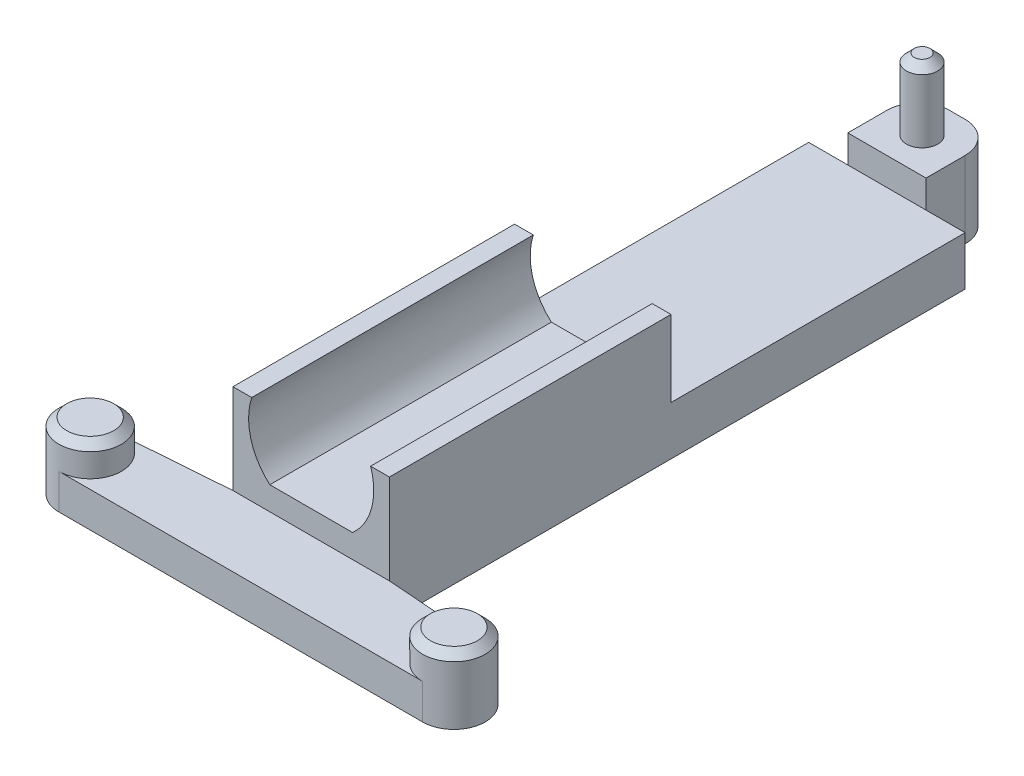
from build123d import *

# Parameters (mm, degrees)
SKETCH1_W           = 96.5
SKETCH1_H           = 110
BOSS_EXTRUDE1_DEPTH = 4.5
SKETCH2_R           = 4
BOSS_EXTRUDE2_DEPTH = 4
SKETCH3_R           = 2
BOSS_EXTRUDE3_DEPTH = 14.4
SKETCH4_W           = 20
SKETCH4_H           = 37.6
BOSS_EXTRUDE4_DEPTH = 1.75
BOSS_EXTRUDE5_DEPTH = 11.5
SKETCH4_5_R         = 2
BOSS_EXTRUDE6_DEPTH = 5.3
CHAMFER2_SIZE       = 1
CUT_EXTRUDE6_DEPTH  = 115.67545509
CHAMFER3_SIZE       = 1
SKETCH2_5_R         = 4
CUT_EXTRUDE9_DEPTH  = 10
CUT_EXTRUDE10_START = -10
SKETCH19_W          = 96.5
SKETCH19_H          = 110
CUT_EXTRUDE10_DEPTH = 10


with BuildPart() as part:
    # Sketch1 → Boss-Extrude1 (new body)
    with BuildSketch(Plane(origin=(0, 0, 0), x_dir=(1, 0, 0), z_dir=(0, 1, 0))):
        with Locations((48.25, -55)):
            Rectangle(SKETCH1_W, SKETCH1_H)
    extrude(amount=BOSS_EXTRUDE1_DEPTH)

    # Sketch2 → Boss-Extrude2 (add)
    with BuildSketch(Plane(origin=(0, 4.5, 0), x_dir=(1, 0, 0), z_dir=(0, 1, 0))):
        with Locations((25, -100)):
            Circle(SKETCH2_R)
        with Locations((71.5, -100)):
            Circle(SKETCH2_R)
    extrude(amount=BOSS_EXTRUDE2_DEPTH)

    # Sketch3 → Boss-Extrude3 (add)
    with BuildSketch(Plane(origin=(0, 4.5, 0), x_dir=(1, 0, 0), z_dir=(0, 1, 0))):
        with Locations((48.25, -16.9)):
            Circle(SKETCH3_R)
    extrude(amount=BOSS_EXTRUDE3_DEPTH)

    # Sketch4 → Boss-Extrude4 (add)
    with BuildSketch(Plane(origin=(0, 4.5, 0), x_dir=(1, 0, 0), z_dir=(0, 1, 0))):
        with Locations((48.25, -40.2)):
            Rectangle(SKETCH4_W, SKETCH4_H)
    extrude(amount=BOSS_EXTRUDE4_DEPTH)

    # Sketch4<3> → Boss-Extrude5 (add)
    with BuildSketch(Plane(origin=(0, 4.5, 0), x_dir=(1, 0, 0), z_dir=(0, 1, 0))):
        Polygon((58.25, -59), (48.25, -59), (38.25, -59), (38.25, -95), (58.25, -95), align=None)
    extrude(amount=BOSS_EXTRUDE5_DEPTH)

    # Sketch4<5> → Boss-Extrude6 (add)
    with BuildSketch(Plane(origin=(0, 4.5, 0), x_dir=(1, 0, 0), z_dir=(0, 1, 0))):
        with BuildLine():
            Line((49.25, -12.4), (47.25, -12.4))
            ThreePointArc((47.25, -12.4), (44.421572875, -13.571572875), (43.25, -16.4))
            Line((43.25, -16.4), (43.25, -21.4))
            Line((43.25, -21.4), (53.25, -21.4))
            Line((53.25, -21.4), (53.25, -16.4))
            ThreePointArc((53.25, -16.4), (52.078427125, -13.571572875), (49.25, -12.4))
        make_face()
        with Locations((48.25, -16.9)):
            Circle(SKETCH4_5_R, mode=Mode.SUBTRACT)
    extrude(amount=BOSS_EXTRUDE6_DEPTH)

    # Chamfer2
    chamfer2_edges = [part.edges().sort_by_distance(p)[0] for p in [
        (46.25, 18.9, 16.9),
    ]]
    chamfer(chamfer2_edges, length=CHAMFER2_SIZE)

    # Sketch9 → Cut-Extrude6 (cut, through all)
    with BuildSketch(Plane(origin=(0, 0, 59), x_dir=(-1, 0, 0), z_dir=(0, 0, -1))):
        with BuildLine():
            ThreePointArc((-55.849342077, 16), (-55.970490222, 11.403805654), (-53.541502622, 7.5))
            Line((-53.541502622, 7.5), (-42.958497378, 7.5))
            ThreePointArc((-42.958497378, 7.5), (-40.958497378, 10.208497378), (-40.25, 13.5))
            ThreePointArc((-40.25, 13.5), (-40.350799515, 14.765950905), (-40.650657923, 16))
            Line((-40.650657923, 16), (-55.849342077, 16))
        make_face()
    extrude(amount=-CUT_EXTRUDE6_DEPTH, mode=Mode.SUBTRACT)

    # Chamfer3
    chamfer3_edges = [part.edges().sort_by_distance(p)[0] for p in [
        (67.5, 8.5, 100),
        (21, 8.5, 100),
    ]]
    chamfer(chamfer3_edges, length=CHAMFER3_SIZE)

    # Sketch2<5> → Cut-Extrude9 (cut)
    with BuildSketch(Plane(origin=(0, 4.5, 0), x_dir=(1, 0, 0), z_dir=(0, 1, 0))):
        with Locations((11, -90)):
            Circle(SKETCH2_5_R)
        with Locations((85.5, -90)):
            Circle(SKETCH2_5_R)
    extrude(amount=-CUT_EXTRUDE9_DEPTH, mode=Mode.SUBTRACT)

    # Sketch19 → Cut-Extrude10 (cut)
    with BuildSketch(Plane(origin=(0, 4.5, 0), x_dir=(1, 0, 0), z_dir=(0, 1, 0)).offset(CUT_EXTRUDE10_START)):
        with Locations((48.25, -55)):
            Rectangle(SKETCH19_W, SKETCH19_H)
        with BuildLine():
            Line((38.25, -95), (25, -96))
            ThreePointArc((25, -96), (21, -100), (25, -104))
            Line((25, -104), (71.5, -104))
            ThreePointArc((71.5, -104), (75.5, -100), (71.5, -96))
            Line((71.5, -96), (58.25, -95))
            Line((58.25, -95), (58.25, -21.4))
            Line((58.25, -21.4), (53.25, -21.4))
            Line((53.25, -21.4), (53.25, -16.4))
            ThreePointArc((53.25, -16.4), (52.078427125, -13.571572875), (49.25, -12.4))
            Line((49.25, -12.4), (47.25, -12.4))
            ThreePointArc((47.25, -12.4), (44.421572875, -13.571572875), (43.25, -16.4))
            Line((43.25, -16.4), (43.25, -21.4))
            Line((43.25, -21.4), (38.25, -21.4))
            Line((38.25, -21.4), (38.25, -95))
        make_face(mode=Mode.SUBTRACT)
    extrude(amount=CUT_EXTRUDE10_DEPTH, mode=Mode.SUBTRACT)


solid = part.part
